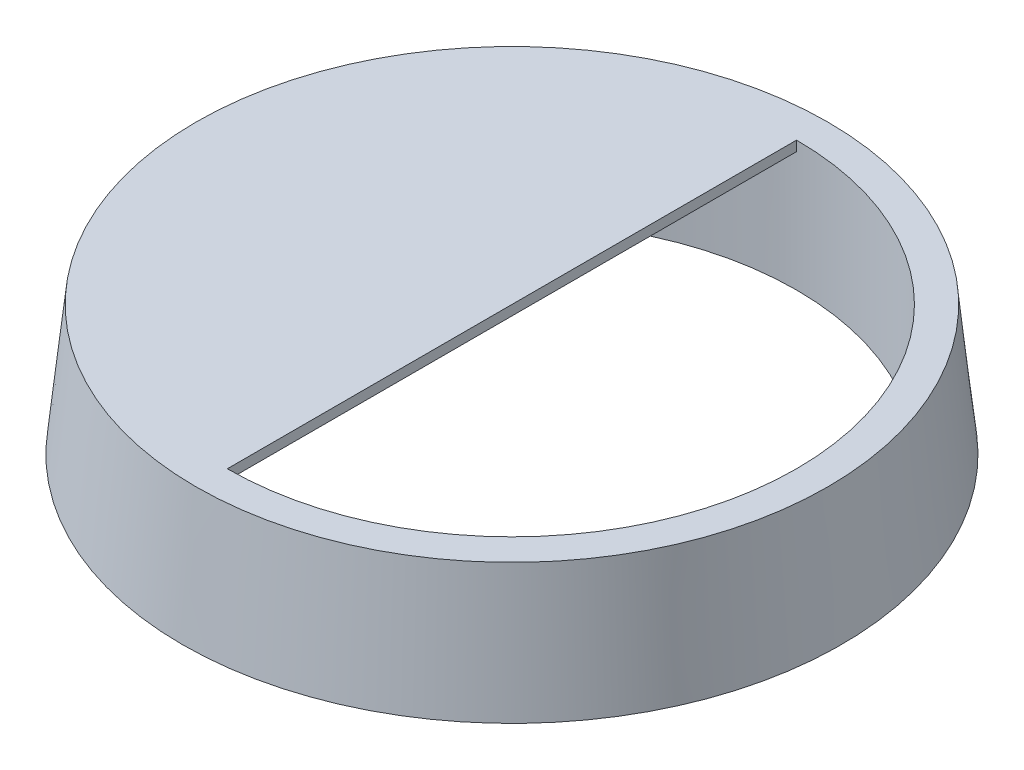
from build123d import *

# Parameters (mm, degrees)
SKETCH1_R           = 16.5
BOSS_EXTRUDE1_DEPTH = 6.5
BOSS_EXTRUDE1_TAPER = 6
SKETCH2_R           = 14.25
CUT_EXTRUDE1_DEPTH  = 4.5
CUT_EXTRUDE2_START  = -6
CUT_EXTRUDE2_DEPTH  = 6
CHAMFER1_SIZE       = 1.5


with BuildPart() as part:
    # Sketch1 → Boss-Extrude1 (new body)
    with BuildSketch(Plane(origin=(0, 0, 0), x_dir=(1, 0, 0), z_dir=(0, 1, 0))):
        Circle(SKETCH1_R)
    extrude(amount=BOSS_EXTRUDE1_DEPTH, taper=BOSS_EXTRUDE1_TAPER)

    # Sketch2 → Cut-Extrude1 (cut)
    with BuildSketch(Plane.XZ):
        with Locations(Location((0, 0, 0), (0, 0, 270))):
            Circle(SKETCH2_R)
    extrude(amount=-CUT_EXTRUDE1_DEPTH, mode=Mode.SUBTRACT)

    # Sketch3 → Cut-Extrude2 (cut)
    with BuildSketch(Plane(origin=(0, 6.5, 0), x_dir=(1, 0, 0), z_dir=(0, 1, 0)).offset(CUT_EXTRUDE2_START)):
        with BuildLine():
            Line((0, -14.25), (0, 14.25))
            ThreePointArc((0, 14.25), (14.25, 0), (0, -14.25))
        make_face()
    extrude(amount=CUT_EXTRUDE2_DEPTH, mode=Mode.SUBTRACT)

    # Chamfer1
    # the kernel refuses this chamfer: 1.5 mm, written as the material it takes off along each edge
    with BuildSketch(Plane(origin=(0, 4.5, 18.107524482), x_dir=(0.027495876610586376, 0.9996219169112968, 0), z_dir=(0, 0, -1))) as chamfer1_piece_1_section:
        Polygon((CHAMFER1_SIZE * 0.999621916911, -CHAMFER1_SIZE * 0.0274958766106), (-CHAMFER1_SIZE * 0.0274958766106, -CHAMFER1_SIZE * 0.999621916911), (0, 0), align=None)
    chamfer1_piece_1 = extrude(amount=36.215048964, mode=Mode.PRIVATE)
    chamfer1_piece_1 = chamfer1_piece_1 & Plane(origin=(0, 5.000185137, 0), x_dir=(0, 0, -1), z_dir=(0, -1, 0)) * Cylinder(14.25, 79, mode=Mode.PRIVATE)
    add(chamfer1_piece_1, mode=Mode.SUBTRACT)


solid = part.part
